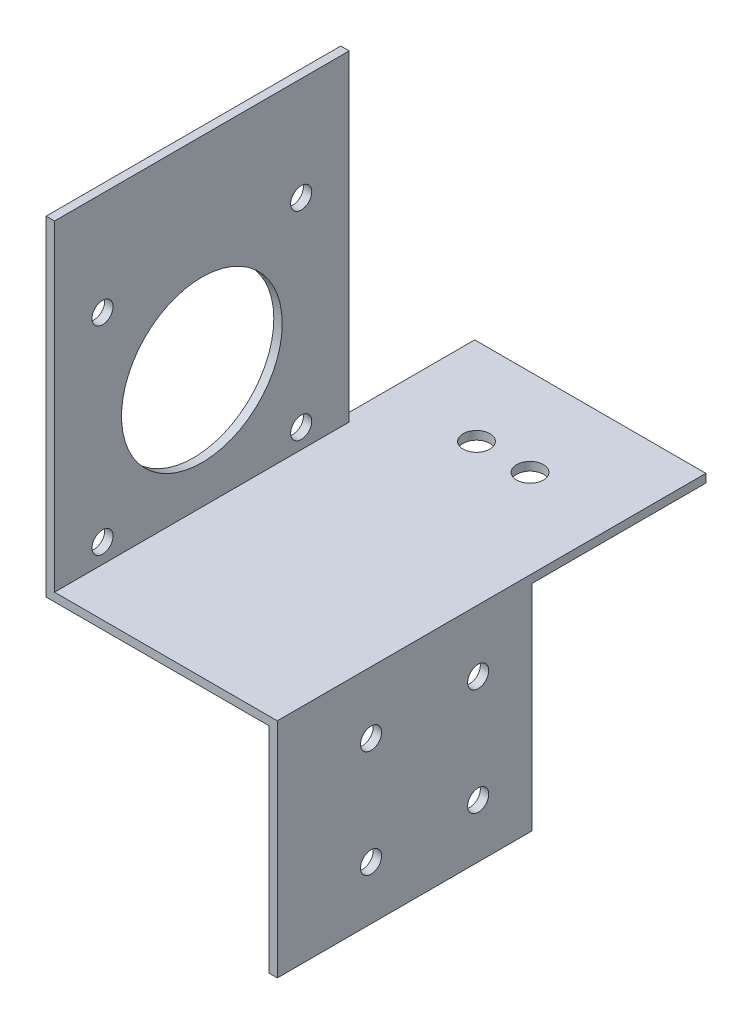
from build123d import *

# Parameters (mm, degrees)
SKETCH1_W           = 69.85
SKETCH1_H           = 50.8
BOSS_EXTRUDE1_DEPTH = 2
SKETCH2_W           = 54.8
SKETCH2_H           = 69.85
BOSS_EXTRUDE2_DEPTH = 2
SKETCH3_W           = 2
SKETCH3_H           = 69.85
BOSS_EXTRUDE3_DEPTH = 76.2
SKETCH4_R           = 19.05
SKETCH4_R_2         = 2.5
CUT_EXTRUDE1_DEPTH  = 122.410689912
SKETCH5_R           = 2.5
SKETCH5_W           = 9.525
SKETCH5_H           = 52.8
CUT_EXTRUDE2_DEPTH  = 76.2
SKETCH6_W           = 54.8
SKETCH6_H           = 2
BOSS_EXTRUDE4_DEPTH = 41.275
SKETCH7_R           = 3.175
CUT_EXTRUDE3_DEPTH  = 116.130515612


with BuildPart() as part:
    # Sketch1 → Boss-Extrude1 (new body)
    with BuildSketch(Plane(origin=(0, 0, 0), x_dir=(0, 0, -1), z_dir=(1, 0, 0))):
        Rectangle(SKETCH1_W, SKETCH1_H)
    extrude(amount=-BOSS_EXTRUDE1_DEPTH)

    # Sketch2 → Boss-Extrude2 (add)
    with BuildSketch(Plane(origin=(0, 25.4, 0), x_dir=(1, 0, 0), z_dir=(0, 1, 0))):
        with Locations((-27.4, 0)):
            Rectangle(SKETCH2_W, SKETCH2_H)
    extrude(amount=BOSS_EXTRUDE2_DEPTH)

    # Sketch3 → Boss-Extrude3 (add)
    with BuildSketch(Plane(origin=(0, 27.4, 0), x_dir=(1, 0, 0), z_dir=(0, 1, 0))):
        with Locations((-53.8, 0)):
            Rectangle(SKETCH3_W, SKETCH3_H)
    extrude(amount=BOSS_EXTRUDE3_DEPTH)

    # Sketch4 → Cut-Extrude1 (cut, through all)
    with BuildSketch(Plane(origin=(-52.8, 0, 0), x_dir=(0, 0, -1), z_dir=(1, 0, 0))):
        with Locations((0, 55.567958179)):
            Circle(SKETCH4_R)
        with Locations((23.55, 79.117958179)):
            Circle(SKETCH4_R_2)
        with Locations((-23.55, 79.117958179)):
            Circle(SKETCH4_R_2)
        with Locations((-23.55, 32.017958179)):
            Circle(SKETCH4_R_2)
        with Locations((23.55, 32.017958179)):
            Circle(SKETCH4_R_2)
    extrude(amount=-CUT_EXTRUDE1_DEPTH, mode=Mode.SUBTRACT)

    # Sketch5 → Cut-Extrude2 (cut)
    with BuildSketch(Plane(origin=(0, 0, 0), x_dir=(0, 0, -1), z_dir=(1, 0, 0))):
        with Locations((-12.7, 12.7)):
            Circle(SKETCH5_R)
        with Locations((12.7, 12.7)):
            Circle(SKETCH5_R)
        with Locations((12.7, -12.7)):
            Circle(SKETCH5_R)
        with Locations((-12.7, -12.7)):
            Circle(SKETCH5_R)
        with Locations((30.1625, 1)):
            Rectangle(SKETCH5_W, SKETCH5_H)
    extrude(amount=-CUT_EXTRUDE2_DEPTH, mode=Mode.SUBTRACT)

    # Sketch6 → Boss-Extrude4 (add)
    with BuildSketch(Plane(origin=(0, 0, -25.4), x_dir=(-1, 0, 0), z_dir=(0, 0, -1))):
        with Locations((27.4, 26.4)):
            Rectangle(SKETCH6_W, SKETCH6_H)
    extrude(amount=BOSS_EXTRUDE4_DEPTH)

    # Sketch7 → Cut-Extrude3 (cut, through all)
    with BuildSketch(Plane(origin=(0, 27.4, 0), x_dir=(1, 0, 0), z_dir=(0, 1, 0))):
        with Locations((-33.75, 46.0375)):
            Circle(SKETCH7_R)
        with Locations((-21.05, 46.0375)):
            Circle(SKETCH7_R)
    extrude(amount=-CUT_EXTRUDE3_DEPTH, mode=Mode.SUBTRACT)


solid = part.part
